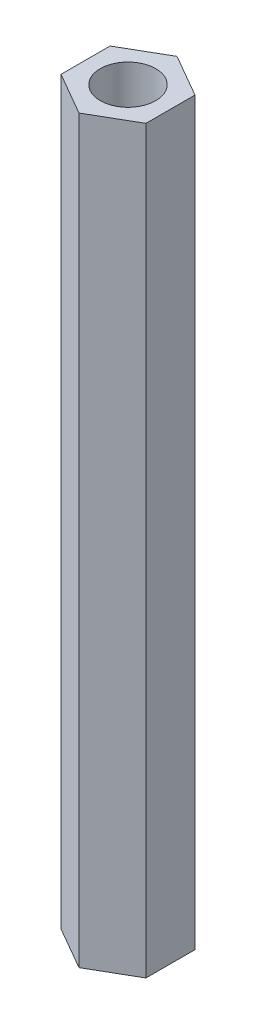
from build123d import *

# Parameters (mm, degrees)
SKETCH2_R           = 1.5
BOSS_EXTRUDE1_DEPTH = 40


with BuildPart() as part:
    # Sketch2 → Boss-Extrude1 (new body)
    with BuildSketch(Plane(origin=(0, 0, 0), x_dir=(1, 0, 0), z_dir=(0, 1, 0))):
        Polygon((0, 2.65), (-2.29496732, 1.325), (-2.29496732, -1.325), (0, -2.65), (2.29496732, -1.325), (2.29496732, 1.325), align=None)
        Circle(SKETCH2_R, mode=Mode.SUBTRACT)
    extrude(amount=BOSS_EXTRUDE1_DEPTH)


solid = part.part
